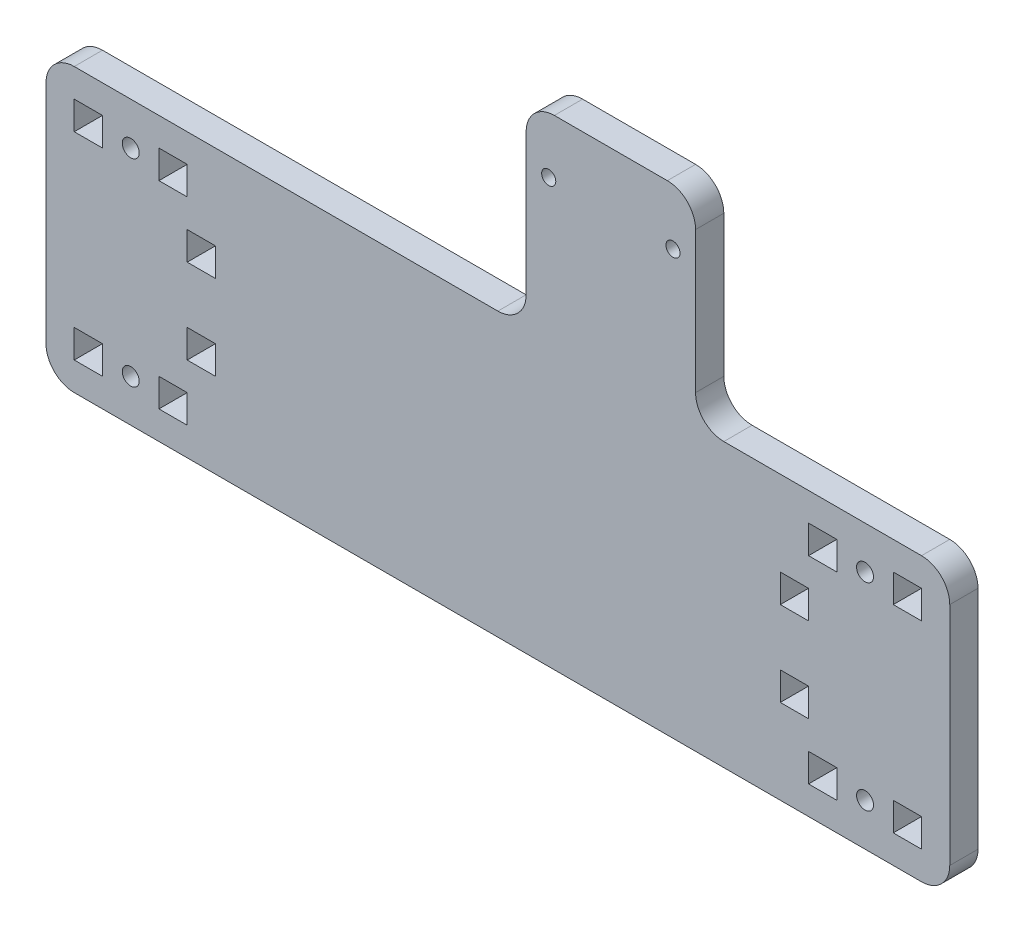
from build123d import *

# Parameters (mm, degrees)
BOSS_EXTRUDE1_OUTLINE_W   = 5
BOSS_EXTRUDE1_OUTLINE_H   = 5
BOSS_EXTRUDE1_OUTLINE_R   = 1.5
BOSS_EXTRUDE1_OUTLINE_R_2 = 1.25
BOSS_EXTRUDE1_DEPTH       = 5
FILLET1_R                 = 5


# Read off the part's stored shape, not the designer's step: Boss-Extrude1
with BuildPart() as part:
    # Boss-Extrude1 outline → Boss-Extrude1 (new body)
    with BuildSketch(Plane.XY):
        Polygon((5, 25), (-80, 25), (-80, -25), (80, -25), (80, 25), (35, 25), (35, 60), (5, 60), align=None)
        with Locations((-72.5, -17.5)):
            Rectangle(BOSS_EXTRUDE1_OUTLINE_W, BOSS_EXTRUDE1_OUTLINE_H, mode=Mode.SUBTRACT)
        with Locations((-65, -17.5)):
            Circle(BOSS_EXTRUDE1_OUTLINE_R, mode=Mode.SUBTRACT)
        with Locations((-57.5, -17.5)):
            Rectangle(BOSS_EXTRUDE1_OUTLINE_W, BOSS_EXTRUDE1_OUTLINE_H, mode=Mode.SUBTRACT)
        with Locations((-52.5, -7.5)):
            Rectangle(BOSS_EXTRUDE1_OUTLINE_W, BOSS_EXTRUDE1_OUTLINE_H, mode=Mode.SUBTRACT)
        with Locations((-52.5, 7.5)):
            Rectangle(BOSS_EXTRUDE1_OUTLINE_W, BOSS_EXTRUDE1_OUTLINE_H, mode=Mode.SUBTRACT)
        with Locations((57.5, -17.5)):
            Rectangle(BOSS_EXTRUDE1_OUTLINE_W, BOSS_EXTRUDE1_OUTLINE_H, mode=Mode.SUBTRACT)
        with Locations((65, -17.5)):
            Circle(BOSS_EXTRUDE1_OUTLINE_R, mode=Mode.SUBTRACT)
        with Locations((72.5, -17.5)):
            Rectangle(BOSS_EXTRUDE1_OUTLINE_W, BOSS_EXTRUDE1_OUTLINE_H, mode=Mode.SUBTRACT)
        with Locations((52.5, -7.5)):
            Rectangle(BOSS_EXTRUDE1_OUTLINE_W, BOSS_EXTRUDE1_OUTLINE_H, mode=Mode.SUBTRACT)
        with Locations((52.5, 7.5)):
            Rectangle(BOSS_EXTRUDE1_OUTLINE_W, BOSS_EXTRUDE1_OUTLINE_H, mode=Mode.SUBTRACT)
        with Locations((-72.5, 17.5)):
            Rectangle(BOSS_EXTRUDE1_OUTLINE_W, BOSS_EXTRUDE1_OUTLINE_H, mode=Mode.SUBTRACT)
        with Locations((-65, 17.5)):
            Circle(BOSS_EXTRUDE1_OUTLINE_R, mode=Mode.SUBTRACT)
        with Locations((-57.5, 17.5)):
            Rectangle(BOSS_EXTRUDE1_OUTLINE_W, BOSS_EXTRUDE1_OUTLINE_H, mode=Mode.SUBTRACT)
        with Locations((57.5, 17.5)):
            Rectangle(BOSS_EXTRUDE1_OUTLINE_W, BOSS_EXTRUDE1_OUTLINE_H, mode=Mode.SUBTRACT)
        with Locations((65, 17.5)):
            Circle(BOSS_EXTRUDE1_OUTLINE_R, mode=Mode.SUBTRACT)
        with Locations((72.5, 17.5)):
            Rectangle(BOSS_EXTRUDE1_OUTLINE_W, BOSS_EXTRUDE1_OUTLINE_H, mode=Mode.SUBTRACT)
        with Locations((9, 50)):
            Circle(BOSS_EXTRUDE1_OUTLINE_R_2, mode=Mode.SUBTRACT)
        with Locations((31, 50)):
            Circle(BOSS_EXTRUDE1_OUTLINE_R_2, mode=Mode.SUBTRACT)
    extrude(amount=BOSS_EXTRUDE1_DEPTH)

    # Fillet1
    fillet1_edges = [part.edges().sort_by_distance(p)[0] for p in [
        (5, 25, 2.5),
        (5, 60, 2.5),
        (35, 60, 2.5),
        (35, 25, 2.5),
        (80, 25, 2.5),
        (80, -25, 2.5),
        (-80, -25, 2.5),
        (-80, 25, 2.5),
    ]]
    fillet(fillet1_edges, radius=FILLET1_R)


solid = part.part
